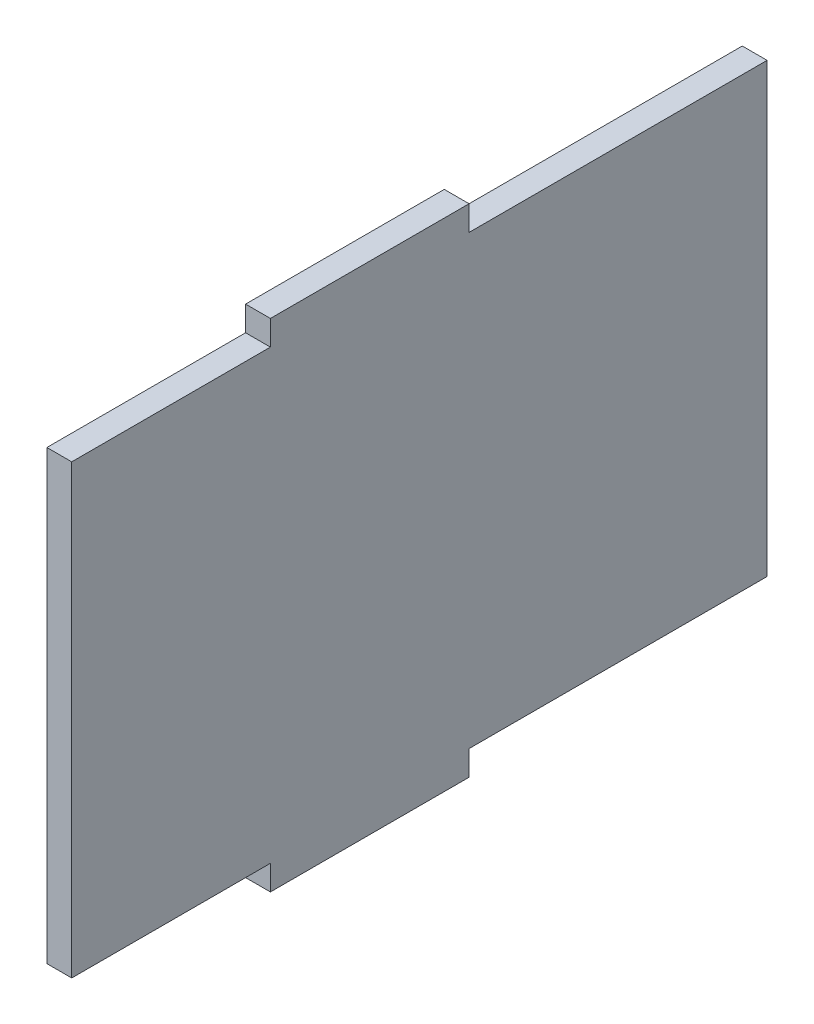
from build123d import *

# Parameters (mm, degrees)
SKETCH1_W           = 88.9
SKETCH1_H           = 63.5
BOSS_EXTRUDE1_DEPTH = 3.175
SKETCH2_W           = 38.1
SKETCH2_H           = 3.175
CUT_EXTRUDE1_DEPTH  = 55.716959208


with BuildPart() as part:
    # Sketch1 → Boss-Extrude1 (new body)
    with BuildSketch(Plane(origin=(0, 0, 0), x_dir=(0, 0, -1), z_dir=(1, 0, 0))):
        Rectangle(SKETCH1_W, SKETCH1_H)
    extrude(amount=BOSS_EXTRUDE1_DEPTH)

    # Sketch2 → Cut-Extrude1 (cut, through all)
    with BuildSketch(Plane(origin=(3.175, 0, 0), x_dir=(0, 0, -1), z_dir=(1, 0, 0))):
        with Locations((25.4, -30.1625)):
            Rectangle(SKETCH2_W, SKETCH2_H)
        Polygon((-19.05, 28.575), (-44.45, 28.575), (-44.45, 31.75), (-41.275, 31.75), (-19.05, 31.75), align=None)
        Polygon((-44.45, -31.75), (-41.275, -31.75), (-19.05, -31.75), (-19.05, -28.575), (-44.45, -28.575), align=None)
        with Locations((25.4, 30.1625)):
            Rectangle(SKETCH2_W, SKETCH2_H)
    extrude(amount=-CUT_EXTRUDE1_DEPTH, mode=Mode.SUBTRACT)


solid = part.part
